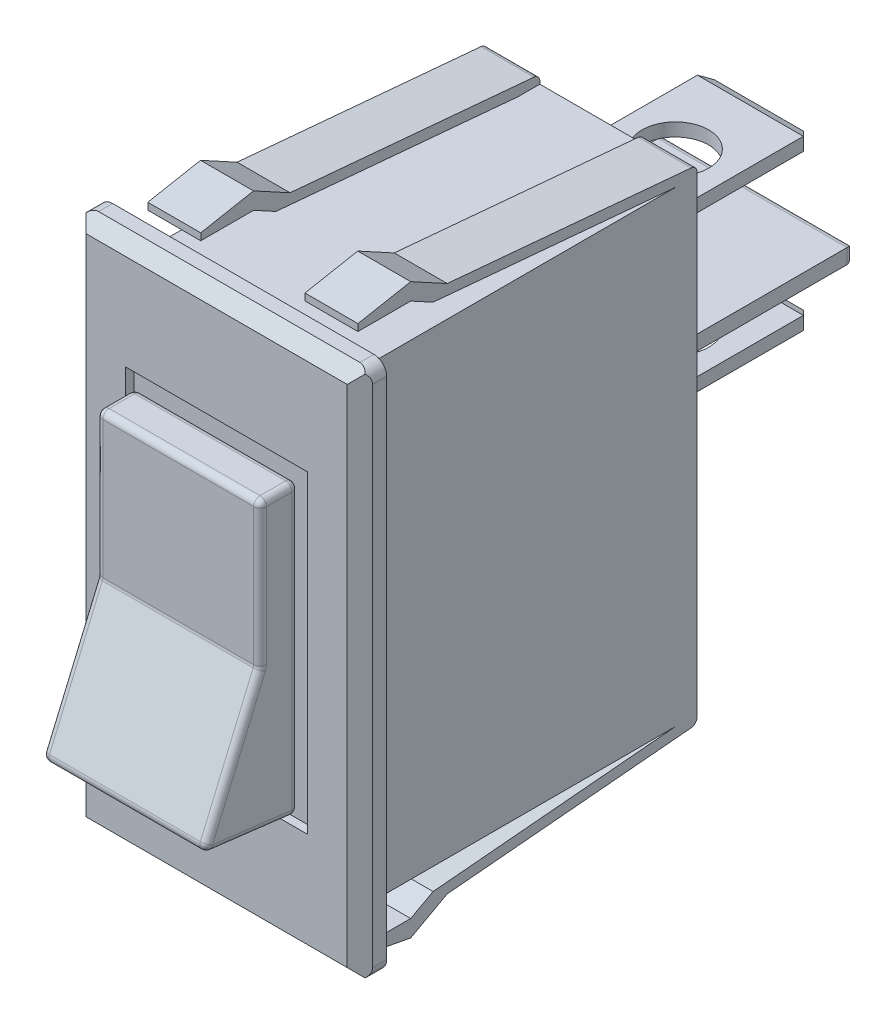
from build123d import *
from OCP.BRepFilletAPI import BRepFilletAPI_MakeChamfer

# Parameters (mm, degrees)
BOSS_EXTRUDE1_DEPTH  = 4.9022
SKETCH3_W            = 17.1958
SKETCH3_H            = 31.8008
BOSS_EXTRUDE2_DEPTH  = 1.6002
CHAMFER1_SIZE        = 0.762
SKETCH4_W            = 10.896044092
SKETCH4_H            = 18.816032884
CUT_EXTRUDE2_DEPTH   = 0.508
SKETCH5_W            = 12.5984
SKETCH5_H            = 27.9908
BOSS_EXTRUDE3_DEPTH  = 20.9042
SKETCH6_W            = 6.35
SKETCH6_H            = 0.7874
BOSS_EXTRUDE4_DEPTH  = 10.0076
CHAMFER2_SIZE        = 0.508
CHAMFER3_SIZE        = 0.508
CHAMFER3_SIZE2       = 0.23688429
SKETCH7_R            = 1.9939
CUT_EXTRUDE3_DEPTH   = 0.7874
LPATTERN1_COUNT      = 2
LPATTERN1_PITCH      = 9.2964
SKETCH9_W            = 11.324393704
SKETCH9_H            = 0.889
BOSS_EXTRUDE5_DEPTH  = 10.0076
FILLET1_R            = 0.381
BOSS_EXTRUDE6_DEPTH  = 3.175
FILLET2_R            = 0.381
FILLET2_OF_MIRROR3_R = 0.381
MIRROR4_START        = -6.2992
MIRROR4_DEPTH        = 3.175
MIRROR4_START_2      = 3.1242
MIRROR4_2_DEPTH      = 3.175
FILLET3_R            = 0.381
FILLET4_R            = 0.762


# Read off the part's stored shape, not the designer's step: Mirror4
with BuildPart() as part:
    # Sketch2 → Boss-Extrude1 (new, symmetric)
    with BuildSketch(Plane(origin=(0, 0, 0), x_dir=(0, 0, -1), z_dir=(1, 0, 0))):
        Polygon((-19.1008, -7.973972857), (-15.705952073, 0), (-15.705952073, 8.666558462), (-13.4112, 8.666558462), (-13.4112, -8.666558462), align=None)
    extrude(amount=BOSS_EXTRUDE1_DEPTH, both=True)

    # Sketch3 → Boss-Extrude2 (add)
    with BuildSketch(Plane(origin=(0, 0, 13.4112), x_dir=(-1, 0, 0), z_dir=(0, 0, -1))):
        Rectangle(SKETCH3_W, SKETCH3_H)
    extrude(amount=BOSS_EXTRUDE2_DEPTH)

    # Chamfer1
    chamfer1_edges = [part.edges().sort_by_distance(p)[0] for p in [
        (-8.5979, 0, 13.4112),
        (0, 15.9004, 13.4112),
        (8.5979, 0, 13.4112),
        (0, -15.9004, 13.4112),
    ]]
    chamfer(chamfer1_edges, length=CHAMFER1_SIZE)

    # Sketch4 → Cut-Extrude2 (cut)
    with BuildSketch(Plane.XY.offset(13.4112)):
        Rectangle(SKETCH4_W, SKETCH4_H)
    extrude(amount=-CUT_EXTRUDE2_DEPTH, mode=Mode.SUBTRACT)


with BuildPart() as cut_extrude2_piece_1:
    # of the separate pieces the step leaves, piece 1, a body of its own (cut_extrude2_pieces)
    add(part.part.solids().sort_by_distance((8.5979, 15.9004, 12.6492))[0])

    # Sketch5 → Boss-Extrude3 (add)
    with BuildSketch(Plane(origin=(0, 0, 11.811), x_dir=(-1, 0, 0), z_dir=(0, 0, -1))):
        Rectangle(SKETCH5_W, SKETCH5_H)
    extrude(amount=BOSS_EXTRUDE3_DEPTH)

    # Sketch9 → Boss-Extrude5 (add)
    with BuildSketch(Plane(origin=(0, 0, -9.0932), x_dir=(-1, 0, 0), z_dir=(0, 0, -1))):
        with Locations((0, 4.6482)):
            Rectangle(SKETCH9_W, SKETCH9_H)
    extrude(amount=BOSS_EXTRUDE5_DEPTH)

    # Fillet1
    fillet1_edges = [cut_extrude2_piece_1.edges().sort_by_distance(p)[0] for p in [
        (-5.662196852, 4.6482, -19.1008),
        (0, 5.0927, -19.1008),
        (5.662196852, 4.6482, -19.1008),
        (0, 4.2037, -19.1008),
    ]]
    fillet(fillet1_edges, radius=FILLET1_R)

    # Sketch11 → Boss-Extrude6 (add)
    with BuildSketch(Plane(origin=(6.2992, 0, 0), x_dir=(0, 0, -1), z_dir=(1, 0, 0))):
        Polygon((9.0932, 13.9954), (9.0932, 14.5034), (-5.880915867, 15.845854324), (-8.069641774, 17.036875135), (-11.233356301, 16.44136473), (-11.233356301, 16.028204475), (-8.069641774, 16.028204475), (-6.727879648, 15.298068915), (7.80245849, 13.9954), align=None)
    boss_extrude6 = extrude(amount=-BOSS_EXTRUDE6_DEPTH)

    # Fillet2
    fillet2_edges = [cut_extrude2_piece_1.edges().sort_by_distance(p)[0] for p in [
        (4.7117, 14.5034, -9.0932),
    ]]
    fillet(fillet2_edges, radius=FILLET2_R)

    # Mirror3: Boss-Extrude6 across plane
    add(boss_extrude6.mirror(Plane(origin=(0, 0, 0), x_dir=(0, 0, 1), z_dir=(1, 0, 0))))

    # Fillet2 of Mirror3
    fillet2_of_mirror3_edges = [cut_extrude2_piece_1.edges().sort_by_distance(p)[0] for p in [
        (-4.7117, 14.5034, -9.0932),
    ]]
    fillet(fillet2_of_mirror3_edges, radius=FILLET2_OF_MIRROR3_R)

    # Mirror4 outline → Mirror4 (add)
    with BuildSketch(Plane.YZ.offset(MIRROR4_START)):
        with BuildLine():
            Line((-16.028204475, 8.069641774), (-16.028204475, 11.233356301))
            Line((-16.028204475, 11.233356301), (-16.44136473, 11.233356301))
            Line((-16.44136473, 11.233356301), (-17.036875135, 8.069641774))
            Line((-17.036875135, 8.069641774), (-15.845854324, 5.880915867))
            Line((-15.845854324, 5.880915867), (-14.534507258, -8.746220836))
            ThreePointArc((-14.534507258, -8.746220836), (-14.412127508, -8.993378714), (-14.155029218, -9.0932))
            Line((-14.155029218, -9.0932), (-13.9954, -9.0932))
            Line((-13.9954, -9.0932), (-13.9954, -7.80245849))
            Line((-13.9954, -7.80245849), (-15.298068915, 6.727879648))
            Line((-15.298068915, 6.727879648), (-16.028204475, 8.069641774))
        make_face()
    extrude(amount=MIRROR4_DEPTH)

    # Mirror4 2 outline → Mirror4 2 (add)
    with BuildSketch(Plane.YZ.offset(MIRROR4_START_2)):
        with BuildLine():
            Line((-16.028204475, 8.069641774), (-16.028204475, 11.233356301))
            Line((-16.028204475, 11.233356301), (-16.44136473, 11.233356301))
            Line((-16.44136473, 11.233356301), (-17.036875135, 8.069641774))
            Line((-17.036875135, 8.069641774), (-15.845854324, 5.880915867))
            Line((-15.845854324, 5.880915867), (-14.534507258, -8.746220836))
            ThreePointArc((-14.534507258, -8.746220836), (-14.412127508, -8.993378714), (-14.155029218, -9.0932))
            Line((-14.155029218, -9.0932), (-13.9954, -9.0932))
            Line((-13.9954, -9.0932), (-13.9954, -7.80245849))
            Line((-13.9954, -7.80245849), (-15.298068915, 6.727879648))
            Line((-15.298068915, 6.727879648), (-16.028204475, 8.069641774))
        make_face()
    extrude(amount=MIRROR4_2_DEPTH)

    # Fillet4
    fillet4_edges = [cut_extrude2_piece_1.edges().sort_by_distance(p)[0] for p in [
        (-8.5979, -15.9004, 12.2301),
        (-8.5979, 15.9004, 12.2301),
        (8.5979, 15.9004, 12.2301),
        (8.5979, -15.9004, 12.2301),
    ]]
    fillet(fillet4_edges, radius=FILLET4_R)


with BuildPart() as cut_extrude2_piece_2:
    # of the separate pieces the step leaves, piece 2, a body of its own (cut_extrude2_pieces)
    add(part.part.solids().sort_by_distance((-4.9022, 8.666558462, 15.705952073))[0])

    # Fillet3
    fillet3_edges = [cut_extrude2_piece_2.edges().sort_by_distance(p)[0] for p in [
        (4.9022, 8.666558462, 14.558576037),
        (4.9022, 4.333279231, 15.705952073),
        (4.9022, -3.986986428, 17.403376037),
        (4.9022, -8.320265659, 16.256),
        (-4.9022, -3.986986428, 17.403376037),
        (-4.9022, 4.333279231, 15.705952073),
        (-4.9022, 8.666558462, 14.558576037),
        (-4.9022, 0, 13.4112),
        (-4.9022, -8.320265659, 16.256),
        (4.9022, 0, 13.4112),
        (0, -7.973972857, 19.1008),
        (0, 0, 15.705952073),
        (0, 8.666558462, 15.705952073),
        (0, 8.666558462, 13.4112),
        (0, -8.666558462, 13.4112),
    ]]
    fillet(fillet3_edges, radius=FILLET3_R)


with BuildPart() as body_3:
    # Sketch6 → Boss-Extrude4 (new body)
    with BuildSketch(Plane(origin=(0, 0, -9.0932), x_dir=(-1, 0, 0), z_dir=(0, 0, -1))):
        with Locations((0, 9.2964)):
            Rectangle(SKETCH6_W, SKETCH6_H)
    extrude(amount=BOSS_EXTRUDE4_DEPTH)

    # Chamfer2
    chamfer2_edges = [body_3.edges().sort_by_distance(p)[0] for p in [
        (3.175, 9.2964, -19.1008),
        (-3.175, 9.2964, -19.1008),
    ]]
    chamfer(chamfer2_edges, length=CHAMFER2_SIZE)

    # Chamfer3: one chamfer whose edges measure the first distance from different faces: ONE call of the kernel's chamfer builder (chamfer() names one face for all edges)
    chamfer3_edges_1 = [body_3.edges().sort_by_distance(p)[0] for p in [
        (0, 8.9027, -19.1008),
    ]]
    chamfer3_side_1 = [body_3.faces().sort_by_distance(p)[0] for p in [
        (0, 8.9027, -14.077287598),
    ]]
    chamfer3_edges_2 = [body_3.edges().sort_by_distance(p)[0] for p in [
        (0, 9.6901, -19.1008),
    ]]
    chamfer3_side_2 = [body_3.faces().sort_by_distance(p)[0] for p in [
        (0, 9.6901, -14.077287598),
    ]]
    chamfer3 = BRepFilletAPI_MakeChamfer(body_3.part.solid().wrapped)
    for e in chamfer3_edges_1:
        chamfer3.Add(CHAMFER3_SIZE, CHAMFER3_SIZE2, e.wrapped, chamfer3_side_1[0].wrapped)  # the first distance lies on this face
    for e in chamfer3_edges_2:
        chamfer3.Add(CHAMFER3_SIZE, CHAMFER3_SIZE2, e.wrapped, chamfer3_side_2[0].wrapped)  # the first distance lies on this face
    add(Compound.cast(chamfer3.Shape()), mode=Mode.REPLACE)

    # Sketch7 → Cut-Extrude3 (cut)
    with BuildSketch(Plane(origin=(0, 9.6901, 0), x_dir=(1, 0, 0), z_dir=(0, 1, 0))):
        with Locations(Location((0, 14.097, 0), (0, 0, 270))):
            Circle(SKETCH7_R)
    extrude(amount=-CUT_EXTRUDE3_DEPTH, mode=Mode.SUBTRACT)


with BuildPart() as lpattern1_1:
    # LPattern1: pattern copy
    add(body_3.part.moved(Location(Vector(0, -1, 0) * (1 * LPATTERN1_PITCH))))


solid = Compound([cut_extrude2_piece_1.part, cut_extrude2_piece_2.part, body_3.part, lpattern1_1.part])
